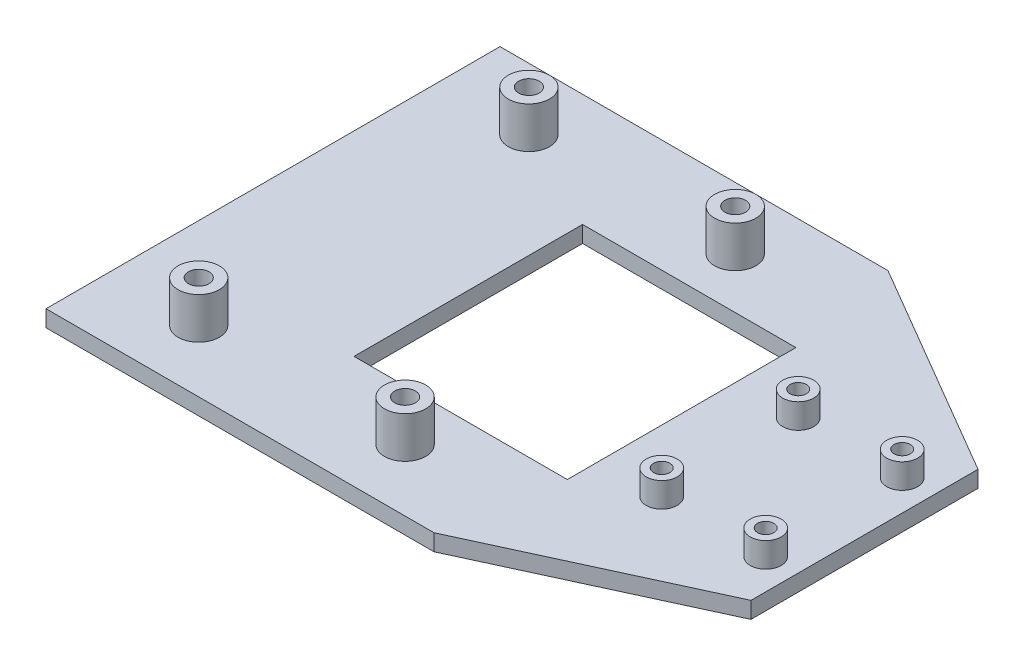
from build123d import *

# Parameters (mm, degrees)
SKETCH1_R           = 1.5875
SKETCH1_R_2         = 1.25
BOSS_EXTRUDE1_DEPTH = 2.54
CUT_EXTRUDE1_DEPTH  = 2.54
SKETCH3_R           = 2.38125
SKETCH3_R_2         = 1.25
BOSS_EXTRUDE2_DEPTH = 3.81
SKETCH5_R           = 3.175
SKETCH5_R_2         = 1.5875
BOSS_EXTRUDE3_DEPTH = 6.35


with BuildPart() as part:
    # Sketch1 → Boss-Extrude1 (new body)
    with BuildSketch(Plane(origin=(0, 0, 0), x_dir=(1, 0, 0), z_dir=(0, 1, 0))):
        Polygon((63.245, 15.376423832), (29.845, 34.925), (-29.845, 34.925), (-29.845, -34.925), (29.845, -34.925), (63.245, -19.548576168), align=None)
        with Locations((-15.875, 25.4)):
            Circle(SKETCH1_R, mode=Mode.SUBTRACT)
        with Locations((15.875, 25.4)):
            Circle(SKETCH1_R, mode=Mode.SUBTRACT)
        with Locations((15.875, -25.4)):
            Circle(SKETCH1_R, mode=Mode.SUBTRACT)
        with Locations((-15.875, -25.4)):
            Circle(SKETCH1_R, mode=Mode.SUBTRACT)
        with Locations((58.545, 8.413923832)):
            Circle(SKETCH1_R_2, mode=Mode.SUBTRACT)
        with Locations((58.545, -12.586076168)):
            Circle(SKETCH1_R_2, mode=Mode.SUBTRACT)
        with Locations((42.545, -12.586076168)):
            Circle(SKETCH1_R_2, mode=Mode.SUBTRACT)
        with Locations((42.545, 8.413923832)):
            Circle(SKETCH1_R_2, mode=Mode.SUBTRACT)
    extrude(amount=BOSS_EXTRUDE1_DEPTH)

    # Sketch2 → Cut-Extrude1 (cut)
    with BuildSketch(Plane(origin=(0, 2.54, 0), x_dir=(1, 0, 0), z_dir=(0, 1, 0))):
        Polygon((29.845, 17.581983721), (33.02, 17.581983721), (33.02, -17.581983721), (29.845, -17.581983721), (0.201756104, -17.581983721), (0.201756104, 17.581983721), align=None)
    extrude(amount=-CUT_EXTRUDE1_DEPTH, mode=Mode.SUBTRACT)

    # Sketch3 → Boss-Extrude2 (add)
    # profile 1 of 4: a face of its own
    with BuildSketch(Plane(origin=(0, 2.54, 0), x_dir=(1, 0, 0), z_dir=(0, 1, 0))):
        with Locations((58.545, 8.413923832)):
            Circle(SKETCH3_R)
        with Locations((58.545, 8.413923832)):
            Circle(SKETCH3_R_2, mode=Mode.SUBTRACT)
    # profile 2 of 4: a face of its own
    with BuildSketch(Plane(origin=(0, 2.54, 0), x_dir=(1, 0, 0), z_dir=(0, 1, 0))):
        with Locations((58.545, -12.586076168)):
            Circle(SKETCH3_R)
        with Locations((58.545, -12.586076168)):
            Circle(SKETCH3_R_2, mode=Mode.SUBTRACT)
    # profile 3 of 4: a face of its own
    with BuildSketch(Plane(origin=(0, 2.54, 0), x_dir=(1, 0, 0), z_dir=(0, 1, 0))):
        with Locations((42.545, -12.586076168)):
            Circle(SKETCH3_R)
        with Locations((42.545, -12.586076168)):
            Circle(SKETCH3_R_2, mode=Mode.SUBTRACT)
    # profile 4 of 4: a face of its own
    with BuildSketch(Plane(origin=(0, 2.54, 0), x_dir=(1, 0, 0), z_dir=(0, 1, 0))):
        with Locations((42.545, 8.413923832)):
            Circle(SKETCH3_R)
        with Locations((42.545, 8.413923832)):
            Circle(SKETCH3_R_2, mode=Mode.SUBTRACT)
    extrude(amount=BOSS_EXTRUDE2_DEPTH)

    # Sketch5 → Boss-Extrude3 (add)
    # profile 1 of 4: a face of its own
    with BuildSketch(Plane(origin=(0, 2.54, 0), x_dir=(1, 0, 0), z_dir=(0, 1, 0))):
        with Locations((-15.875, 25.4)):
            Circle(SKETCH5_R)
        with Locations((-15.875, 25.4)):
            Circle(SKETCH5_R_2, mode=Mode.SUBTRACT)
    # profile 2 of 4: a face of its own
    with BuildSketch(Plane(origin=(0, 2.54, 0), x_dir=(1, 0, 0), z_dir=(0, 1, 0))):
        with Locations((15.875, 25.4)):
            Circle(SKETCH5_R)
        with Locations((15.875, 25.4)):
            Circle(SKETCH5_R_2, mode=Mode.SUBTRACT)
    # profile 3 of 4: a face of its own
    with BuildSketch(Plane(origin=(0, 2.54, 0), x_dir=(1, 0, 0), z_dir=(0, 1, 0))):
        with Locations((15.875, -25.4)):
            Circle(SKETCH5_R)
        with Locations((15.875, -25.4)):
            Circle(SKETCH5_R_2, mode=Mode.SUBTRACT)
    # profile 4 of 4: a face of its own
    with BuildSketch(Plane(origin=(0, 2.54, 0), x_dir=(1, 0, 0), z_dir=(0, 1, 0))):
        with Locations((-15.875, -25.4)):
            Circle(SKETCH5_R)
        with Locations((-15.875, -25.4)):
            Circle(SKETCH5_R_2, mode=Mode.SUBTRACT)
    extrude(amount=BOSS_EXTRUDE3_DEPTH)


solid = part.part
